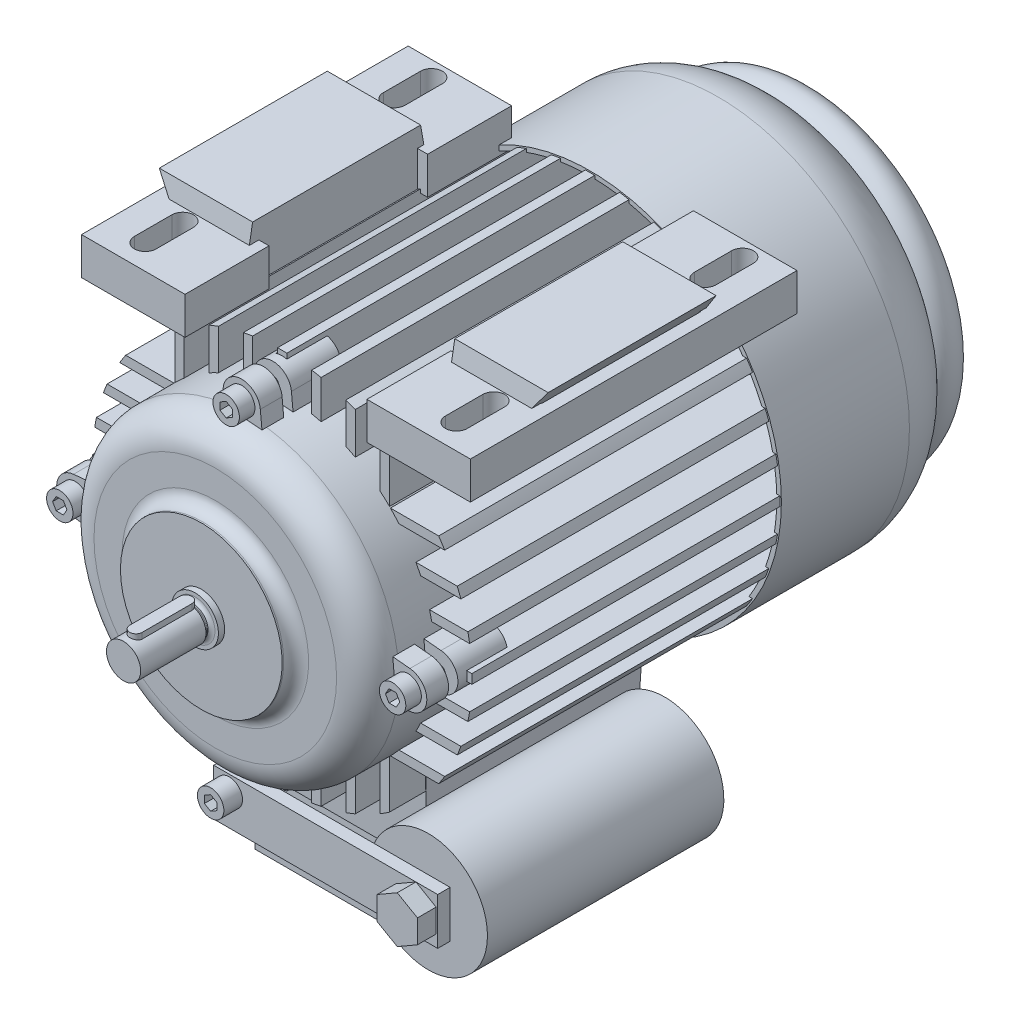
from build123d import *

# Parameters (mm, degrees)
BOSS_EXTRUDE1_DEPTH         = 53
BOSS_EXTRUDE2_START         = -7
BOSS_EXTRUDE2_DEPTH         = 7
SKETCH4_R                   = 4.250000000000001
BOSS_EXTRUDE3_DEPTH         = 5
CUT_EXTRUDE1_DEPTH          = 4
SKETCH6_R                   = 2.0000000000000004
BOSS_EXTRUDE4_DEPTH         = 3
BOSS_EXTRUDE5_START         = 16
BOSS_EXTRUDE5_DEPTH         = 16
CUT_EXTRUDE2_REACH          = 218.167
CUT_EXTRUDE2_END_RADIUS     = 48.999999999999986
SKETCH9_W                   = 3
SKETCH9_H                   = 106.00000000000003
CIRPATTERN2_COUNT           = 4
CIRPATTERN16_COUNT          = 4
FILLET1_R                   = 1
BOSS_EXTRUDE6_DEPTH         = 7
CUT_EXTRUDE3_REACH          = 238.648
FILL_START                  = -14.026164829
FILL_PATTERN1_OUTLINE_W     = 7.5
FILL_PATTERN1_OUTLINE_H     = 1.5
FILL_PATTERN1_OUTLINE_W_2   = 7.4999999999999964
FILL_PATTERN1_DEPTH         = 7.5
FILL_START_2                = -3.75
FILL_PATTERN1_2_OUTLINE_W   = 7.499999999999998
FILL_PATTERN1_2_OUTLINE_H   = 1.5
FILL_PATTERN1_2_OUTLINE_W_2 = 7.4999999999999964
FILL_PATTERN1_2_DEPTH       = 7.5
FILL_START_3                = 6.526164829
FILL_PATTERN1_3_OUTLINE_W   = 7.5
FILL_PATTERN1_3_OUTLINE_H   = 1.5
FILL_PATTERN1_3_OUTLINE_W_2 = 7.4999999999999964
FILL_PATTERN1_3_DEPTH       = 7.5
FILL_START_4                = -24.302329658
FILL_PATTERN1_4_OUTLINE_W   = 7.500000000000001
FILL_PATTERN1_4_OUTLINE_H   = 1.5
FILL_PATTERN1_4_OUTLINE_W_2 = 7.499999999999998
FILL_PATTERN1_4_OUTLINE_W_3 = 7.4999999999999964
FILL_PATTERN1_4_DEPTH       = 7.5
FILL_START_5                = 16.802329658
FILL_PATTERN1_5_OUTLINE_W   = 7.500000000000001
FILL_PATTERN1_5_OUTLINE_H   = 1.5
FILL_PATTERN1_5_OUTLINE_W_2 = 7.499999999999998
FILL_PATTERN1_5_OUTLINE_W_3 = 7.4999999999999964
FILL_PATTERN1_5_DEPTH       = 7.5
FILL_START_6                = -34.578494488
FILL_PATTERN1_6_OUTLINE_W   = 7.5
FILL_PATTERN1_6_OUTLINE_H   = 1.5
FILL_PATTERN1_6_DEPTH       = 7.5
FILL_START_7                = 27.078494488
FILL_PATTERN1_7_OUTLINE_W   = 7.5
FILL_PATTERN1_7_OUTLINE_H   = 1.5
FILL_PATTERN1_7_DEPTH       = 7.5
BOSS_EXTRUDE7_DEPTH         = 18
DRAFT2_ANGLE                = -35.00000000000008
DRAFT3_ANGLE                = 10.000000000000021
SKETCH14_W                  = 33.2642887469416
SKETCH14_H                  = 26.999999999999986
BOSS_EXTRUDE8_DEPTH         = 12
SKETCH15_W                  = 4
SKETCH15_H                  = 54
BOSS_EXTRUDE9_DEPTH         = 12
CUT_EXTRUDE4_REACH          = 263.608
SKETCH_PATTERN1_START       = 51
SKETCH_PATTERN1_DEPTH       = 12
SKETCH_PATTERN1_START_2     = 27.447036231
SKETCH_PATTERN1_2_DEPTH     = 23.552963769
BOSS_EXTRUDE10_DEPTH        = 4
SKETCH18_R                  = 4.250000000000002
BOSS_EXTRUDE11_DEPTH        = 5
SKETCH19_R                  = 19.000000000000004
BOSS_EXTRUDE12_DEPTH        = 76
BOSS_EXTRUDE13_OUTLINE_W    = 67.636496902
BOSS_EXTRUDE13_OUTLINE_H    = 67.63649690199998
BOSS_EXTRUDE13_DEPTH        = 37.5
BOSS_EXTRUDE13_DRAFT        = -2
BOSS_EXTRUDE14_DEPTH        = 25
BOSS_EXTRUDE15_DEPTH        = 6
BOSS_EXTRUDE16_DEPTH        = 10.5
SKETCH24_R                  = 8.999999999999995
BOSS_EXTRUDE17_DEPTH        = 4
FILLET3_R                   = 4


with BuildPart() as part:
    # Sketch1 → Revolve1 (revolve)
    with BuildSketch(Plane(origin=(0, 0, 0), x_dir=(0, 0, -1), z_dir=(1, 0, 0)), mode=Mode.PRIVATE) as revolve1_sk:
        with BuildLine():
            Line((0, 0), (0, 5.499999999999979))
            Line((0, 5.499999999999979), (20.999999999999996, 5.499999999999978))
            Line((20.999999999999996, 5.499999999999978), (22, 4.85161011785243))
            Line((22, 4.85161011785243), (23, 4.85161011785243))
            Line((23, 4.85161011785243), (23, 5.499999999999979))
            Line((23, 5.499999999999979), (23.000000000000004, 7.499999999999982))
            Line((23.000000000000004, 7.499999999999982), (25, 7.499999999999982))
            Line((25, 7.499999999999982), (24.999999999999993, 25.999999999999982))
            Line((24.999999999999993, 25.999999999999982), (25.49999999999997, 25.999999999999982))
            ThreePointArc((25.49999999999997, 25.999999999999982), (28.32842712474619, 27.171572875253794), (29.5, 30.00000000000001))
            Line((29.5, 30.00000000000001), (29.5, 38.999999999999986))
            ThreePointArc((29.5, 38.999999999999986), (32.428932188134524, 46.07106781186546), (39.5, 48.999999999999986))
            Line((39.5, 48.999999999999986), (164.99999999999997, 48.999999999999986))
            ThreePointArc((164.99999999999997, 48.999999999999986), (172.07106781186548, 46.07106781186548), (175, 38.999999999999986))
            Line((175, 38.999999999999986), (175, 0))
            Line((175, 0), (0, 0))
        make_face()
    revolve(revolve1_sk.sketch.rotate(Axis((0, 0, -175), (0, 0, 1)), 90), axis=Axis((0, 0, -175), (0, 0, 1)))

    # Sketch2 → Boss-Extrude1 (add, symmetric)
    with BuildSketch(Plane(origin=(0, 0, -104), x_dir=(-1, 0, 0), z_dir=(0, 0, -1))):
        with BuildLine():
            Line((-60.98155458825234, -1.5), (-48.97703543498727, -1.5))
            ThreePointArc((-48.97703543498727, -1.5), (-48.999999999999986, 6e-15), (-48.97703543498727, 1.5))
            Line((-48.97703543498727, 1.5), (-60.98155458825234, 1.5))
            ThreePointArc((-60.98155458825234, 1.5), (-61, 7.47e-15), (-60.98155458825234, -1.5))
        make_face()
        with BuildLine():
            Line((-60.25570512407933, 9.5), (-48.07026107688618, 9.5))
            ThreePointArc((-48.07026107688618, 9.5), (-47.748093866449764, 11.005431937034613), (-47.37879272417142, 12.499999999999998))
            Line((-47.37879272417142, 12.499999999999998), (-59.705527382311935, 12.499999999999998))
            ThreePointArc((-59.705527382311935, 12.499999999999998), (-59.999369380961966, 11.003439184495171), (-60.25570512407933, 9.5))
        make_face()
        with BuildLine():
            Line((-57.452154006616674, 20.499999999999996), (-44.50561762294731, 20.49999999999999))
            ThreePointArc((-44.50561762294731, 20.49999999999999), (-43.777061211425675, 22.012926013846688), (-42.99709292498736, 23.5))
            Line((-42.99709292498736, 23.5), (-56.29165124598851, 23.5))
            ThreePointArc((-56.29165124598851, 23.5), (-56.89168048436997, 22.007650752962178), (-57.452154006616674, 20.499999999999996))
        make_face()
        with BuildLine():
            Line((-52.23743868146676, 31.5), (-37.53331853167261, 31.5))
            ThreePointArc((-37.53331853167261, 31.5), (-36.19567022940389, 33.02837350891266), (-34.795833083862185, 34.5))
            Line((-34.795833083862185, 34.5), (-50.306560208386344, 34.5))
            ThreePointArc((-50.306560208386344, 34.5), (-51.2939365527793, 33.01411929643818), (-52.23743868146676, 31.5))
        make_face()
        with BuildLine():
            Line((-50.306560208386315, -34.5), (-34.795833083862156, -34.5))
            ThreePointArc((-34.795833083862156, -34.5), (-36.19567022940386, -33.02837350891266), (-37.533318531672585, -31.5))
            Line((-37.533318531672585, -31.5), (-52.237438681466735, -31.5))
            ThreePointArc((-52.237438681466735, -31.5), (-51.29393655277928, -33.01411929643817), (-50.306560208386315, -34.5))
        make_face()
        with BuildLine():
            Line((-56.29165124598848, -23.5), (-42.997092924987335, -23.5))
            ThreePointArc((-42.997092924987335, -23.5), (-43.77706121142564, -22.012926013846695), (-44.505617622947284, -20.49999999999999))
            Line((-44.505617622947284, -20.49999999999999), (-57.452154006616645, -20.499999999999996))
            ThreePointArc((-57.452154006616645, -20.499999999999996), (-56.89168048436994, -22.00765075296217), (-56.29165124598848, -23.5))
        make_face()
        with BuildLine():
            Line((-59.70552738231191, -12.499999999999998), (-47.37879272417139, -12.499999999999998))
            ThreePointArc((-47.37879272417139, -12.499999999999998), (-47.748093866449736, -11.005431937034606), (-48.070261076886155, -9.5))
            Line((-48.070261076886155, -9.5), (-60.2557051240793, -9.5))
            ThreePointArc((-60.2557051240793, -9.5), (-59.999369380961944, -11.003439184495166), (-59.70552738231191, -12.499999999999998))
        make_face()
    boss_extrude1 = extrude(amount=BOSS_EXTRUDE1_DEPTH, both=True)

    # Sketch3 → Boss-Extrude2 (add)
    with BuildSketch(Plane.XY.offset(-38).offset(BOSS_EXTRUDE2_START)):
        with BuildLine():
            Line((-5.972660809070251, 54.072121368064735), (-6.4999999999999964, 48.56696408053522))
            ThreePointArc((-6.4999999999999964, 48.56696408053522), (3e-15, 48.999999999999986), (6.4999999999999964, 48.56696408053522))
            Line((6.4999999999999964, 48.56696408053522), (5.972660809070251, 54.072121368064735))
            ThreePointArc((5.972660809070251, 54.072121368064735), (3.7e-16, 59.5), (-5.972660809070251, 54.072121368064735))
        make_face()
    boss_extrude2 = extrude(amount=BOSS_EXTRUDE2_DEPTH)

    # Sketch4 → Boss-Extrude3 (add)
    with BuildSketch(Plane.XY.offset(-38)):
        with Locations((0, 53.5)):
            Circle(SKETCH4_R)
    boss_extrude3 = extrude(amount=BOSS_EXTRUDE3_DEPTH)

    # Sketch5 → Cut-Extrude1 (cut)
    with BuildSketch(Plane.XY.offset(-33)):
        Polygon((-4.36e-15, 55.80940107675851), (-1.9999999999999996, 54.65470053837926), (-1.9999999999999996, 52.34529946162075), (3.89e-15, 51.190598923241495), (2, 52.34529946162074), (2, 54.65470053837926), align=None)
    cut_extrude1 = extrude(amount=-CUT_EXTRUDE1_DEPTH, mode=Mode.SUBTRACT)

    # Sketch6 → Boss-Extrude4 (add)
    with BuildSketch(Plane(origin=(0, 0, -45), x_dir=(-1, 0, 0), z_dir=(0, 0, -1))):
        with Locations(Location((0, 53.5, 0), (0, 0, 180))):
            Circle(SKETCH6_R)
    boss_extrude4 = extrude(amount=BOSS_EXTRUDE4_DEPTH)

    # Sketch7 → Boss-Extrude5 (add)
    with BuildSketch(Plane(origin=(0, 0, -48), x_dir=(-1, 0, 0), z_dir=(0, 0, -1)).offset(BOSS_EXTRUDE5_START)):
        with BuildLine():
            Line((5.972660809070251, 54.072121368064735), (6.4999999999999964, 48.56696408053522))
            ThreePointArc((6.4999999999999964, 48.56696408053522), (3e-15, 48.999999999999986), (-6.499999999999995, 48.56696408053523))
            Line((-6.499999999999995, 48.56696408053523), (-5.972660809070251, 54.072121368064735))
            ThreePointArc((-5.972660809070251, 54.072121368064735), (3.7e-16, 59.5), (5.972660809070251, 54.072121368064735))
        make_face()
    boss_extrude5 = extrude(amount=-BOSS_EXTRUDE5_DEPTH)

    # Cut-Extrude2: up to this cylinder (the profile starts outside it)
    cut_extrude2_end = Plane(origin=(0, 0, -104), z_dir=(0, 0, -1)) * Cylinder(CUT_EXTRUDE2_END_RADIUS, 535.334, mode=Mode.PRIVATE)
    # Sketch9 → Cut-Extrude2 (cut, up to the surface)
    with BuildSketch(Plane(origin=(-5.650292137768756, 58.986222670206395, 0), x_dir=(0.9954434681783757, 0.09535356134412158, 0), z_dir=(-0.0953535613441216, 0.9954434681783758, 0)), mode=Mode.PRIVATE) as cut_extrude2_sk1:
        with Locations((5.101415531910503, 104.00000000000001)):
            Rectangle(SKETCH9_W, SKETCH9_H)
    cut_extrude2_tool1 = extrude(cut_extrude2_sk1.sketch, amount=-CUT_EXTRUDE2_REACH, mode=Mode.PRIVATE) - cut_extrude2_end
    add(cut_extrude2_tool1.solids().sort_by_distance((-0.572121, 59.472661, -104))[0], mode=Mode.SUBTRACT)

    # CirPattern2: Boss-Extrude1 ×4 about axis
    cirpattern2_axis = Axis((-4e-17, -2e-17, 0), (0, 0, 1))
    for i in range(1, CIRPATTERN2_COUNT):
        add(boss_extrude1.rotate(cirpattern2_axis, i * 360 / CIRPATTERN2_COUNT))

    # CirPattern16: Boss-Extrude2, Boss-Extrude3, Cut-Extrude1, Boss-Extrude4, Boss-Extrude5 ×4 about axis
    cirpattern16_axis = Axis((3.361e-14, 2.5e-16, 0), (0, 0, 1))
    add([boss_extrude2.rotate(cirpattern16_axis, i * 360 / CIRPATTERN16_COUNT) for i in range(1, CIRPATTERN16_COUNT)])
    add([boss_extrude3.rotate(cirpattern16_axis, i * 360 / CIRPATTERN16_COUNT) for i in range(1, CIRPATTERN16_COUNT)])
    add([cut_extrude1.rotate(cirpattern16_axis, i * 360 / CIRPATTERN16_COUNT) for i in range(1, CIRPATTERN16_COUNT)], mode=Mode.SUBTRACT)
    add([boss_extrude4.rotate(cirpattern16_axis, i * 360 / CIRPATTERN16_COUNT) for i in range(1, CIRPATTERN16_COUNT)])
    add([boss_extrude5.rotate(cirpattern16_axis, i * 360 / CIRPATTERN16_COUNT) for i in range(1, CIRPATTERN16_COUNT)])

    # Fillet1
    fillet1_edges = [part.edges().sort_by_distance(p)[0] for p in [
        (4.85161011785243, -1.13e-15, -22),
    ]]
    fillet(fillet1_edges, radius=FILLET1_R)

    # Fillet2: read off the stored shape, not the designer's step
    # Fillet2 outline → Fillet2 (revolve)
    with BuildSketch(Plane.XZ):
        with BuildLine():
            ThreePointArc((6.375040478, -23), (5.535888548, -22.815440453), (4.851610118, -22.295824038))
            Line((4.851610118, -22.295824038), (4.851610118, -23))
            Line((4.851610118, -23), (6.375040478, -23))
        make_face()
    revolve(axis=Axis((0, 0, 0), (0, 0, 1)))

    # Sketch10 → Boss-Extrude6 (add)
    with BuildSketch(Plane(origin=(0, 0, 0), x_dir=(1, 0, 0), z_dir=(0, 1, 0))):
        with BuildLine():
            Line((-2, 4), (-2, 20))
            ThreePointArc((-2, 20), (1.2e-16, 22), (2, 20))
            Line((2, 20), (2, 4))
            ThreePointArc((2, 4), (-3.7e-16, 2), (-2, 4))
        make_face()
    extrude(amount=BOSS_EXTRUDE6_DEPTH)

    # Sketch11 → Revolve2 (revolve)
    with BuildSketch(Plane(origin=(0, 0, 0), x_dir=(1, 0, 0), z_dir=(0, 1, 0))):
        with BuildLine():
            Line((60.00000000000001, 150), (60.000000000000014, 191.16674735950411))
            ThreePointArc((60.000000000000014, 191.16674735950411), (56.3496684813514, 202.68578987830338), (46.731165945009494, 210))
            ThreePointArc((46.731165945009494, 210), (50.39842667917902, 217.14281640431741), (42.5, 218.58624408584524))
            Line((42.5, 218.58624408584524), (3e-16, 218.58624408584524))
            Line((3e-16, 218.58624408584524), (0, 220.08624408584524))
            Line((0, 220.08624408584524), (41.952267240638086, 220.08624408584524))
            ThreePointArc((41.952267240638086, 220.08624408584524), (50.92202184046736, 219.0756114067182), (50.232837038368714, 210.07545028028082))
            ThreePointArc((50.232837038368714, 210.07545028028082), (58.46965073201071, 202.17229150041493), (61.50000000000001, 191.16674735950411))
            Line((61.50000000000001, 191.16674735950411), (61.50000000000001, 150))
            Line((61.50000000000001, 150), (60.00000000000001, 150))
        make_face()
    revolve(axis=Axis((0, 0, 0), (0, 0, -1)))

    # Sketch12 → Cut-Extrude3 (cut, up to next)
    with BuildSketch(Plane(origin=(3e-16, 0, -220.08624408584524), x_dir=(-1, 0, 0), z_dir=(0, 0, -1)), mode=Mode.PRIVATE) as cut_extrude3_sk1:
        Polygon((-3.749999999999999, 3.75), (3.750000000000001, 3.75), (3.7500000000000018, -3.75), (-3.7499999999999982, -3.75), align=None)
    cut_extrude3_tool1 = extrude(cut_extrude3_sk1.sketch, amount=-CUT_EXTRUDE3_REACH, mode=Mode.PRIVATE) & part.part
    add(cut_extrude3_tool1.solids().sort_by_distance((0, 0, -220.086244))[0], mode=Mode.SUBTRACT)

    # Fill Pattern1: read off the stored shape, not the designer's step
    # Fill Pattern1 outline → Fill Pattern1 (cut)
    with BuildSketch(Plane(origin=(0, 0, 0), x_dir=(1, 0, 0), z_dir=(0, 1, 0)).offset(FILL_START)):
        with Locations((5.932946530000001, 219.336244086)):
            Rectangle(FILL_PATTERN1_OUTLINE_W, FILL_PATTERN1_OUTLINE_H)
        with Locations((-5.932946530000001, 219.336244086)):
            Rectangle(FILL_PATTERN1_OUTLINE_W, FILL_PATTERN1_OUTLINE_H)
        with Locations((17.798839591, 219.336244086)):
            Rectangle(FILL_PATTERN1_OUTLINE_W, FILL_PATTERN1_OUTLINE_H)
        with Locations((-17.798839591, 219.336244086)):
            Rectangle(FILL_PATTERN1_OUTLINE_W, FILL_PATTERN1_OUTLINE_H)
        with Locations((29.664732651999998, 219.336244086)):
            Rectangle(FILL_PATTERN1_OUTLINE_W_2, FILL_PATTERN1_OUTLINE_H)
        with Locations((-29.664732651999998, 219.336244086)):
            Rectangle(FILL_PATTERN1_OUTLINE_W_2, FILL_PATTERN1_OUTLINE_H)
    extrude(amount=FILL_PATTERN1_DEPTH, mode=Mode.SUBTRACT)

    # Fill Pattern1 2 outline → Fill Pattern1 2 (cut)
    with BuildSketch(Plane(origin=(0, 0, 0), x_dir=(1, 0, 0), z_dir=(0, 1, 0)).offset(FILL_START_2)):
        with Locations((11.865893060999998, 219.336244086)):
            Rectangle(FILL_PATTERN1_2_OUTLINE_W, FILL_PATTERN1_2_OUTLINE_H)
        with Locations((-11.865893060999998, 219.336244086)):
            Rectangle(FILL_PATTERN1_2_OUTLINE_W, FILL_PATTERN1_2_OUTLINE_H)
        with Locations((23.731786121999995, 219.336244086)):
            Rectangle(FILL_PATTERN1_2_OUTLINE_W_2, FILL_PATTERN1_2_OUTLINE_H)
        with Locations((-23.731786121999995, 219.336244086)):
            Rectangle(FILL_PATTERN1_2_OUTLINE_W_2, FILL_PATTERN1_2_OUTLINE_H)
        with Locations((35.597679182, 219.336244086)):
            Rectangle(FILL_PATTERN1_2_OUTLINE_W_2, FILL_PATTERN1_2_OUTLINE_H)
        with Locations((-35.597679182, 219.336244086)):
            Rectangle(FILL_PATTERN1_2_OUTLINE_W_2, FILL_PATTERN1_2_OUTLINE_H)
    extrude(amount=FILL_PATTERN1_2_DEPTH, mode=Mode.SUBTRACT)

    # Fill Pattern1 3 outline → Fill Pattern1 3 (cut)
    with BuildSketch(Plane(origin=(0, 0, 0), x_dir=(1, 0, 0), z_dir=(0, 1, 0)).offset(FILL_START_3)):
        with Locations((5.932946530000001, 219.336244086)):
            Rectangle(FILL_PATTERN1_3_OUTLINE_W, FILL_PATTERN1_3_OUTLINE_H)
        with Locations((-5.932946530000001, 219.336244086)):
            Rectangle(FILL_PATTERN1_3_OUTLINE_W, FILL_PATTERN1_3_OUTLINE_H)
        with Locations((17.798839591, 219.336244086)):
            Rectangle(FILL_PATTERN1_3_OUTLINE_W, FILL_PATTERN1_3_OUTLINE_H)
        with Locations((-17.798839591, 219.336244086)):
            Rectangle(FILL_PATTERN1_3_OUTLINE_W, FILL_PATTERN1_3_OUTLINE_H)
        with Locations((29.664732651999998, 219.336244086)):
            Rectangle(FILL_PATTERN1_3_OUTLINE_W_2, FILL_PATTERN1_3_OUTLINE_H)
        with Locations((-29.664732651999998, 219.336244086)):
            Rectangle(FILL_PATTERN1_3_OUTLINE_W_2, FILL_PATTERN1_3_OUTLINE_H)
    extrude(amount=FILL_PATTERN1_3_DEPTH, mode=Mode.SUBTRACT)

    # Fill Pattern1 4 outline → Fill Pattern1 4 (cut)
    with BuildSketch(Plane(origin=(0, 0, 0), x_dir=(1, 0, 0), z_dir=(0, 1, 0)).offset(FILL_START_4)):
        with Locations((0, 219.336244086)):
            Rectangle(FILL_PATTERN1_4_OUTLINE_W, FILL_PATTERN1_4_OUTLINE_H)
        with Locations((11.865893060999998, 219.336244086)):
            Rectangle(FILL_PATTERN1_4_OUTLINE_W_2, FILL_PATTERN1_4_OUTLINE_H)
        with Locations((-11.865893060999998, 219.336244086)):
            Rectangle(FILL_PATTERN1_4_OUTLINE_W_2, FILL_PATTERN1_4_OUTLINE_H)
        with Locations((23.731786121999995, 219.336244086)):
            Rectangle(FILL_PATTERN1_4_OUTLINE_W_3, FILL_PATTERN1_4_OUTLINE_H)
        with Locations((-23.731786121999995, 219.336244086)):
            Rectangle(FILL_PATTERN1_4_OUTLINE_W_3, FILL_PATTERN1_4_OUTLINE_H)
    extrude(amount=FILL_PATTERN1_4_DEPTH, mode=Mode.SUBTRACT)

    # Fill Pattern1 5 outline → Fill Pattern1 5 (cut)
    with BuildSketch(Plane(origin=(0, 0, 0), x_dir=(1, 0, 0), z_dir=(0, 1, 0)).offset(FILL_START_5)):
        with Locations((0, 219.336244086)):
            Rectangle(FILL_PATTERN1_5_OUTLINE_W, FILL_PATTERN1_5_OUTLINE_H)
        with Locations((11.865893060999998, 219.336244086)):
            Rectangle(FILL_PATTERN1_5_OUTLINE_W_2, FILL_PATTERN1_5_OUTLINE_H)
        with Locations((-11.865893060999998, 219.336244086)):
            Rectangle(FILL_PATTERN1_5_OUTLINE_W_2, FILL_PATTERN1_5_OUTLINE_H)
        with Locations((23.731786121999995, 219.336244086)):
            Rectangle(FILL_PATTERN1_5_OUTLINE_W_3, FILL_PATTERN1_5_OUTLINE_H)
        with Locations((-23.731786121999995, 219.336244086)):
            Rectangle(FILL_PATTERN1_5_OUTLINE_W_3, FILL_PATTERN1_5_OUTLINE_H)
    extrude(amount=FILL_PATTERN1_5_DEPTH, mode=Mode.SUBTRACT)

    # Fill Pattern1 6 outline → Fill Pattern1 6 (cut)
    with BuildSketch(Plane(origin=(0, 0, 0), x_dir=(1, 0, 0), z_dir=(0, 1, 0)).offset(FILL_START_6)):
        with Locations((5.932946530000001, 219.336244086)):
            Rectangle(FILL_PATTERN1_6_OUTLINE_W, FILL_PATTERN1_6_OUTLINE_H)
        with Locations((-5.932946530000001, 219.336244086)):
            Rectangle(FILL_PATTERN1_6_OUTLINE_W, FILL_PATTERN1_6_OUTLINE_H)
        with Locations((17.798839591, 219.336244086)):
            Rectangle(FILL_PATTERN1_6_OUTLINE_W, FILL_PATTERN1_6_OUTLINE_H)
        with Locations((-17.798839591, 219.336244086)):
            Rectangle(FILL_PATTERN1_6_OUTLINE_W, FILL_PATTERN1_6_OUTLINE_H)
    extrude(amount=FILL_PATTERN1_6_DEPTH, mode=Mode.SUBTRACT)

    # Fill Pattern1 7 outline → Fill Pattern1 7 (cut)
    with BuildSketch(Plane(origin=(0, 0, 0), x_dir=(1, 0, 0), z_dir=(0, 1, 0)).offset(FILL_START_7)):
        with Locations((5.932946530000001, 219.336244086)):
            Rectangle(FILL_PATTERN1_7_OUTLINE_W, FILL_PATTERN1_7_OUTLINE_H)
        with Locations((-5.932946530000001, 219.336244086)):
            Rectangle(FILL_PATTERN1_7_OUTLINE_W, FILL_PATTERN1_7_OUTLINE_H)
        with Locations((17.798839591, 219.336244086)):
            Rectangle(FILL_PATTERN1_7_OUTLINE_W, FILL_PATTERN1_7_OUTLINE_H)
        with Locations((-17.798839591, 219.336244086)):
            Rectangle(FILL_PATTERN1_7_OUTLINE_W, FILL_PATTERN1_7_OUTLINE_H)
    extrude(amount=FILL_PATTERN1_7_DEPTH, mode=Mode.SUBTRACT)

    # Sketch13 → Boss-Extrude7 (add)
    with BuildSketch(Plane(origin=(0, 51, 0), x_dir=(1, 0, 0), z_dir=(0, 1, 0))):
        Polygon((-62.499999999999986, 128), (-62.499999999999986, 74), (-32.49999999999999, 74), (-32.499999999999986, 128), align=None)
        Polygon((32.499999999999986, 128), (62.499999999999986, 128), (62.499999999999986, 74), (32.49999999999999, 74), align=None)
    extrude(amount=BOSS_EXTRUDE7_DEPTH)

    # Draft2
    draft2_faces = [part.faces().sort_by_distance(p)[0] for p in [
        (62.499999999999986, 60, -101),
        (-62.499999999999986, 60, -101),
    ]]
    draft(draft2_faces, Plane.ZX.offset(68.99999999999999), DRAFT2_ANGLE)

    # Draft3
    draft3_faces = [part.faces().sort_by_distance(p)[0] for p in [
        (-44.636737998579655, 60.804567463386995, -128),
        (-44.63673799857967, 60.80456746338698, -74),
        (44.63673799857965, 60.80456746338699, -128),
        (44.636737998579655, 60.80456746338699, -74),
    ]]
    draft(draft3_faces, Plane.ZX.offset(68.99999999999999), DRAFT3_ANGLE)

    # Sketch14 → Boss-Extrude8 (add)
    with BuildSketch(Plane(origin=(0, 51, 0), x_dir=(1, 0, 0), z_dir=(0, 1, 0))):
        Polygon((29.235711253058405, 49), (62.5, 48.99999999999999), (62.5, 76), (29.235711253058405, 76), align=None)
        with Locations((-45.867855626529206, 140.5)):
            Rectangle(SKETCH14_W, SKETCH14_H)
        with Locations((45.867855626529206, 140.5)):
            Rectangle(SKETCH14_W, SKETCH14_H)
        Polygon((-62.5, 48.99999999999999), (-62.5, 76), (-29.235711253058405, 76), (-29.235711253058405, 49), align=None)
    extrude(amount=BOSS_EXTRUDE8_DEPTH)

    # Sketch15 → Boss-Extrude9 (add)
    with BuildSketch(Plane(origin=(0, 51, 0), x_dir=(1, 0, 0), z_dir=(0, 1, 0))):
        with Locations((-60.499999999999986, 101)):
            Rectangle(SKETCH15_W, SKETCH15_H)
        with Locations((60.499999999999986, 101)):
            Rectangle(SKETCH15_W, SKETCH15_H)
    extrude(amount=BOSS_EXTRUDE9_DEPTH)

    # Sketch16 → Cut-Extrude4 (cut, up to next)
    with BuildSketch(Plane(origin=(0, 63, 0), x_dir=(1, 0, 0), z_dir=(0, 1, 0)), mode=Mode.PRIVATE) as cut_extrude4_sk1:
        with BuildLine():
            Line((-46.50000000000004, 148.99999999999997), (-46.500000000000036, 136.99999999999994))
            ThreePointArc((-46.500000000000036, 136.99999999999994), (-50.00000000000002, 133.49999999999994), (-53.500000000000014, 136.99999999999994))
            Line((-53.500000000000014, 136.99999999999994), (-53.50000000000002, 148.99999999999997))
            ThreePointArc((-53.50000000000002, 148.99999999999997), (-50.00000000000003, 152.49999999999994), (-46.50000000000004, 148.99999999999997))
        make_face()
    cut_extrude4_tool1 = extrude(cut_extrude4_sk1.sketch, amount=-CUT_EXTRUDE4_REACH, mode=Mode.PRIVATE) & part.part
    add(cut_extrude4_tool1.solids().sort_by_distance((-50, 63, -143))[0], mode=Mode.SUBTRACT)

    # Sketch-Pattern1: read off the stored shape, not the designer's step
    # Sketch-Pattern1 outline → Sketch-Pattern1 (cut)
    with BuildSketch(Plane(origin=(0, 0, 0), x_dir=(1, 0, 0), z_dir=(0, 1, 0)).offset(SKETCH_PATTERN1_START)):
        with BuildLine():
            ThreePointArc((-46.5, 69), (-50, 72.5), (-53.5, 69))
            Line((-53.5, 69), (-53.5, 57))
            ThreePointArc((-53.5, 57), (-50, 53.5), (-46.5, 57))
            Line((-46.5, 57), (-46.5, 69))
        make_face()
        with BuildLine():
            Line((46.5, 149), (46.5, 137))
            ThreePointArc((46.5, 137), (50, 133.5), (53.5, 137))
            Line((53.5, 137), (53.5, 149))
            ThreePointArc((53.5, 149), (50, 152.5), (46.5, 149))
        make_face()
        with BuildLine():
            ThreePointArc((53.5, 69), (50, 72.5), (46.5, 69))
            Line((46.5, 69), (46.5, 57))
            ThreePointArc((46.5, 57), (50, 53.5), (53.5, 57))
            Line((53.5, 57), (53.5, 69))
        make_face()
    extrude(amount=SKETCH_PATTERN1_DEPTH, mode=Mode.SUBTRACT)

    # Sketch-Pattern1 2 outline → Sketch-Pattern1 2 (cut)
    with BuildSketch(Plane(origin=(0, 0, 0), x_dir=(1, 0, 0), z_dir=(0, 1, 0)).offset(SKETCH_PATTERN1_START_2)):
        with BuildLine():
            ThreePointArc((-53.5, 137), (-53.168677594, 135.513567254), (-52.237438681, 134.308556494))
            ThreePointArc((-52.237438681, 134.308556494), (-48.513567254, 133.831322406), (-46.5, 137))
            Line((-46.5, 137), (-46.5, 149))
            ThreePointArc((-46.5, 149), (-49.494706462, 152.463333429), (-53.354101966, 150))
            ThreePointArc((-53.354101966, 150), (-53.463333429, 149.505293538), (-53.5, 149))
            Line((-53.5, 149), (-53.5, 137))
        make_face()
    extrude(amount=SKETCH_PATTERN1_2_DEPTH, mode=Mode.SUBTRACT)

    # Sketch17 → Boss-Extrude10 (add)
    with BuildSketch(Plane.XY.offset(-38)):
        Polygon((-5.000000000000001, -48.5), (66.99999999999999, -48.5), (66.99999999999999, -63.5), (-5.000000000000004, -63.5), align=None)
    extrude(amount=BOSS_EXTRUDE10_DEPTH)

    # Sketch18 → Boss-Extrude11 (add)
    with BuildSketch(Plane.XY.offset(-33)):
        with Locations((0, -53.5)):
            Circle(SKETCH18_R)
        Polygon((-2, -54.65470053837926), (4.36e-15, -55.80940107675851), (1.9999999999999996, -54.65470053837926), (1.9999999999999996, -52.34529946162075), (-3.9e-15, -51.190598923241495), (-2, -52.34529946162074), align=None, mode=Mode.SUBTRACT)
    extrude(amount=BOSS_EXTRUDE11_DEPTH)

    # Sketch19 → Boss-Extrude12 (add)
    with BuildSketch(Plane(origin=(0, 0, -38), x_dir=(-1, 0, 0), z_dir=(0, 0, -1))):
        with Locations(Location((-59.99999999999999, -56, 0), (0, 0, 336.750437409))):
            Circle(SKETCH19_R)
    extrude(amount=BOSS_EXTRUDE12_DEPTH)


with BuildPart() as boss_extrude13_tool:
    # Boss-Extrude13: read off the stored shape, not the designer's step
    # Boss-Extrude13 outline → Boss-Extrude13 (with draft: the straight prism first)
    with BuildSketch(Plane(origin=(0, -72, 0), x_dir=(1, 0, 0), z_dir=(0, 1, 0))):
        with Locations((0, 97.25)):
            Rectangle(BOSS_EXTRUDE13_OUTLINE_W, BOSS_EXTRUDE13_OUTLINE_H)
    extrude(amount=BOSS_EXTRUDE13_DEPTH)
    # Boss-Extrude13: the draft: its side faces are tilted about the plane it starts from
    boss_extrude13_sides = [boss_extrude13_tool.faces().sort_by_distance(p)[0] for p in [
        (33.818248451, -53.25, -97.25),
        (0, -53.25, -131.068248451),
        (-33.818248451, -53.25, -97.25),
        (0, -53.25, -63.431751549),
    ]]
    draft(boss_extrude13_sides, Plane(origin=(0, -72, 0), x_dir=(1, 0, 0), z_dir=(0, 1, 0)), BOSS_EXTRUDE13_DRAFT)


with BuildPart() as part_1:
    add(part.part)

    # Boss-Extrude13: add boss_extrude13_tool
    add(boss_extrude13_tool.part)

    # Sketch21 → Boss-Extrude14 (add)
    with BuildSketch(Plane.XZ.offset(72.00000000000001)):
        Polygon((-31.499999999999993, -73.75000000000001), (-23.499999999999993, -65.75), (23.499999999999993, -65.75), (31.499999999999993, -73.75000000000001), (31.5, -120.74999999999997), (23.5, -128.74999999999997), (-23.499999999999986, -128.74999999999997), (-31.499999999999986, -120.74999999999997), align=None)
    extrude(amount=BOSS_EXTRUDE14_DEPTH)

    # Sketch22 → Boss-Extrude15 (add)
    with BuildSketch(Plane.XY.offset(-34)):
        Polygon((60, -63.50000000000003), (66.49519052838329, -59.75), (66.49519052838329, -52.25000000000003), (59.99999999999998, -48.5), (53.50480947161668, -52.25000000000003), (53.50480947161668, -59.75), align=None)
    extrude(amount=BOSS_EXTRUDE15_DEPTH)

    # Sketch23 → Boss-Extrude16 (add)
    with BuildSketch(Plane.ZY.offset(31.500000000000007)):
        Polygon((-107.64230484541326, -84.49999999999999), (-102.44615242270662, -93.5), (-92.05384757729335, -93.5), (-86.85769515458674, -84.5), (-92.05384757729337, -75.49999999999999), (-102.44615242270662, -75.49999999999999), align=None)
    extrude(amount=BOSS_EXTRUDE16_DEPTH)

    # Sketch24 → Boss-Extrude17 (add)
    with BuildSketch(Plane.ZY.offset(41.99999999999999)):
        with Locations(Location((-97.24999999999999, -84.5, 0), (0, 0, 150))):
            Circle(SKETCH24_R)
    extrude(amount=BOSS_EXTRUDE17_DEPTH)

    # Fillet3
    fillet3_edges = [part_1.edges().sort_by_distance(p)[0] for p in [
        (-45.99999999999999, -89, -89.45577136594004),
    ]]
    fillet(fillet3_edges, radius=FILLET3_R - 0.0001)  # a hair under: the kernel refuses the full size


solid = part_1.part
